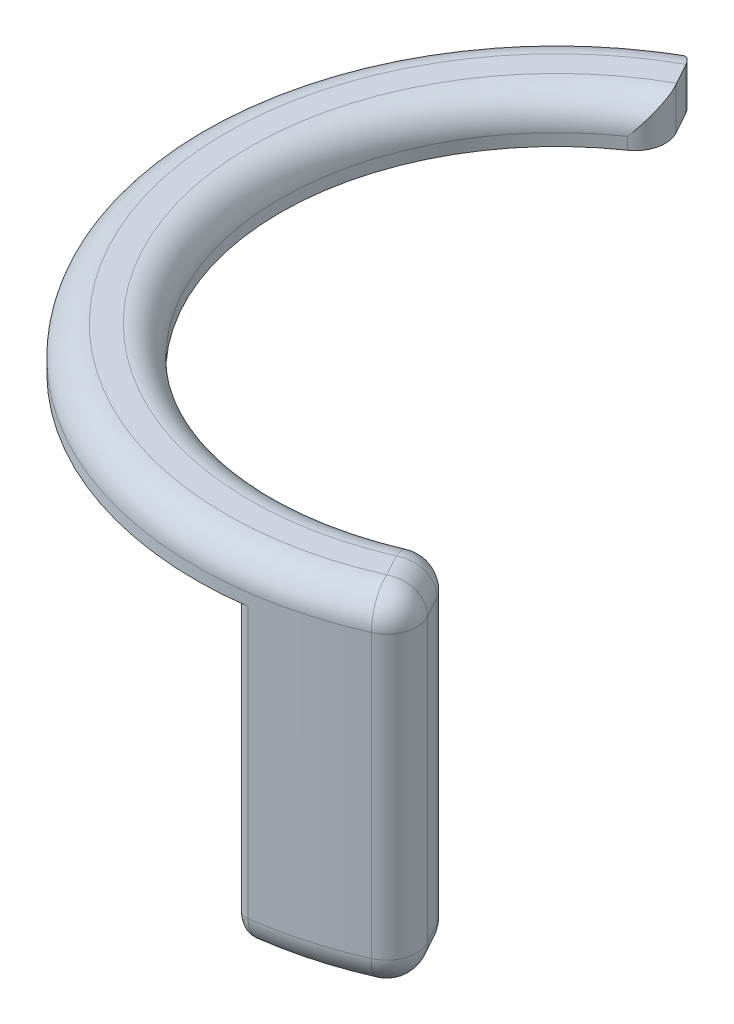
from build123d import *

# Parameters (mm, degrees)
EXTRUDE_THIN1_DEPTH = 28.5
FILLET1_R           = 2.5
CUT_EXTRUDE1_DEPTH  = 25
FILLET3_R           = 1


with BuildPart() as part:
    # Sketch1 → Extrude-Thin1 (new body)
    with BuildSketch(Plane(origin=(0, 0, 0), x_dir=(1, 0, 0), z_dir=(0, 1, 0))):
        with BuildLine():
            ThreePointArc((14.502410436, -26.261761014), (-26.261761014, -14.502410436), (-14.502410436, 26.261761014))
            Line((-14.502410436, 26.261761014), (-11.118514667, 20.134016777))
            ThreePointArc((-11.118514667, 20.134016777), (-20.134016777, -11.118514667), (11.118514667, -20.134016777))
            Line((11.118514667, -20.134016777), (14.502410436, -26.261761014))
        make_face()
    extrude(amount=EXTRUDE_THIN1_DEPTH)

    # Fillet1
    fillet1_edges = [part.edges().sort_by_distance(p)[0] for p in [
        (-11.118514667, 14.25, -20.134016777),
        (-14.502410436, 14.25, -26.261761014),
        (-20.134016777, 28.5, 11.118514667),
        (-26.261761014, 28.5, 14.502410436),
        (14.502410436, 14.25, 26.261761014),
        (11.118514667, 14.25, 20.134016777),
        (12.810462551, 28.5, 23.197888896),
        (12.810462551, 0, 23.197888896),
        (-26.261761014, 0, 14.502410436),
        (-20.134016777, 0, 11.118514667),
    ]]
    fillet(fillet1_edges, radius=FILLET1_R)

    # Sketch2 → Cut-Extrude1 (cut)
    with BuildSketch(Plane.XZ):
        Polygon((0, 0), (4.257878393, 41.970587923), (-45.190508324, 20.690876889), (-19.784587909, -38.345722602), align=None)
    extrude(amount=-CUT_EXTRUDE1_DEPTH, mode=Mode.SUBTRACT)

    # Fillet3
    fillet3_edges = [part.edges().sort_by_distance(p)[0] for p in [
        (2.321413988, 13.75, 22.882548746),
        (2.395319033, 0.732233047, 23.611042589),
        (3.027931289, 13.75, 29.846802712),
        (2.954026244, 0.732233047, 29.118308869),
        (2.674672638, 0, 26.364675729),
    ]]
    fillet(fillet3_edges, radius=FILLET3_R)


solid = part.part
